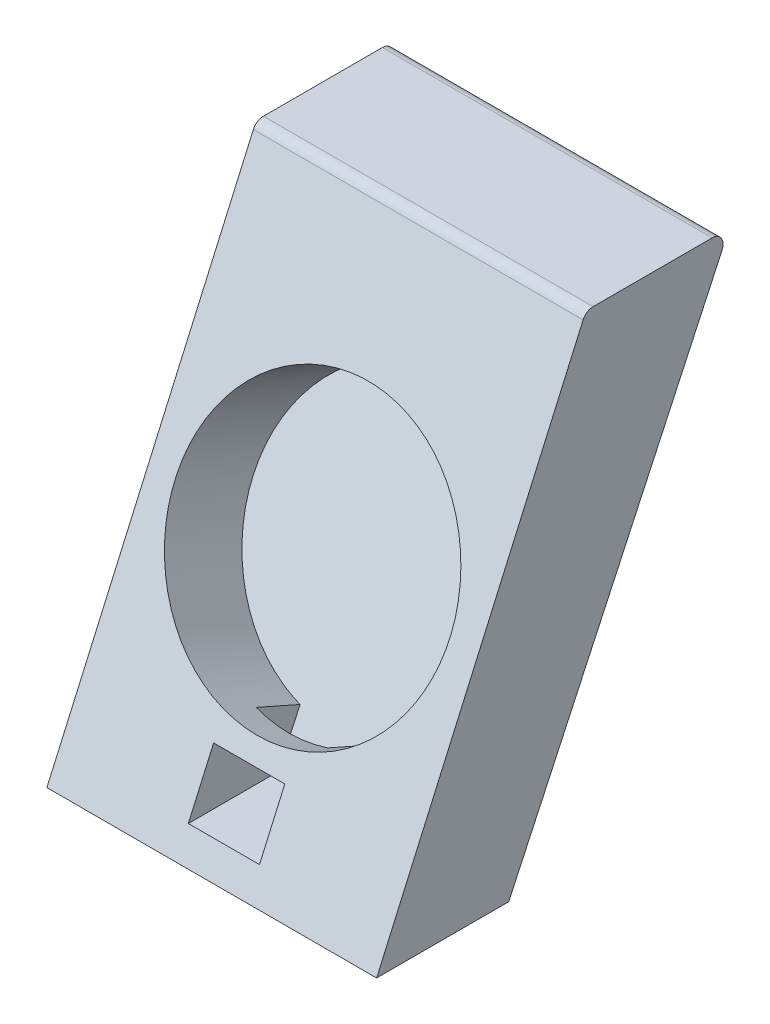
from build123d import *

# Parameters (mm, degrees)
BOSS_EXTRUDE1_DEPTH      = 76.2
FILLET1_R                = 2.54
CUT_EXTRUDE1_REACH       = 157.479
SKETCH2_R                = 31.75
CUT_EXTRUDE6_START       = 4
CUT_EXTRUDE6_DEPTH       = 14.602057312
CUT_EXTRUDE6_START_2     = 18.602057312
CUT_EXTRUDE6_2_DEPTH     = 2.80902025
CUT_EXTRUDE6_START_3     = 12.7
CUT_EXTRUDE6_3_OUTLINE_W = 57
CUT_EXTRUDE6_3_OUTLINE_H = 10
CUT_EXTRUDE6_3_DEPTH     = 2.568810953
CUT_EXTRUDE7_REACH       = 157.479
SKETCH12_W               = 16.443444888
SKETCH12_H               = 13.2134825
CUT_EXTRUDE9_REACH       = 134.385
SKETCH13_W               = 16.443444888
SKETCH13_H               = 11.069902364


with BuildPart() as part:
    # Sketch1 → Boss-Extrude1 (new body)
    with BuildSketch(Plane(origin=(0, 0, 0), x_dir=(0, 0, -1), z_dir=(1, 0, 0))):
        Polygon((0, 0), (30.524795297, 0), (81.513688576, 109.346034506), (48.380392686, 109.346034506), align=None)
    extrude(amount=BOSS_EXTRUDE1_DEPTH)

    # Fillet1
    fillet1_edges = [part.edges().sort_by_distance(p)[0] for p in [
        (38.1, 109.346034506, -48.380392686),
        (38.1, 109.346034506, -81.513688576),
    ]]
    fillet(fillet1_edges, radius=FILLET1_R)

    # Cut-Extrude1: up to this plane
    cut_extrude1_end = Plane(origin=(76.2, 3.803564356, -22.368025214), z_dir=(0, 0.4226182617406973, 0.906307787036651))
    # Sketch2 → Cut-Extrude1 (cut, up to the surface)
    with BuildSketch(Plane(origin=(0, 0, 0), x_dir=(1, 0, 0), z_dir=(0, 0.4046165331441324, 0.9144864466499344)), mode=Mode.PRIVATE) as cut_extrude1_sk1:
        with Locations(Location((37.912855144, 58.087931451, 0), (0, 0, 270))):
            Circle(SKETCH2_R)
    cut_extrude1_tool1 = split(extrude(cut_extrude1_sk1.sketch, amount=-CUT_EXTRUDE1_REACH, mode=Mode.PRIVATE), bisect_by=cut_extrude1_end, keep=Keep.BOTH, mode=Mode.PRIVATE)
    add(cut_extrude1_tool1.solids().sort_by_distance((37.912855, 53.120626, -23.503337))[0], mode=Mode.SUBTRACT)

    # Cut-Extrude6: read off the stored shape, not the designer's step
    # Cut-Extrude6 outline → Cut-Extrude6 (cut)
    with BuildSketch(Plane(origin=(0, 0, 0), x_dir=(1, 0, 0), z_dir=(0, 0.9144864466499345, -0.4046165331441322)).offset(CUT_EXTRUDE6_START)):
        with BuildLine():
            add(Edge.make_bspline(
                [(14.29054348, 10.655346562), (8.791282166, 10.655346562), (11.540912823, 15.416915606), (14.29054348, 20.17848465), (17.040174137, 15.416915606), (19.789804794, 10.655346562), (14.29054348, 10.655346562)],
                knots=[0, 0, 0, 2.094395102, 2.094395102, 4.188790205, 4.188790205, 6.283185307, 6.283185307, 6.283185307], degree=2, weights=[1, 0.5, 1, 0.5, 1, 0.5, 1]))
        make_face()
        with BuildLine():
            add(Edge.make_bspline(
                [(61.90945652, 17.004105287), (67.408717834, 17.004105287), (64.659087177, 12.242536243), (61.90945652, 7.4809672), (59.159825863, 12.242536243), (56.410195206, 17.004105287), (61.90945652, 17.004105287)],
                knots=[0, 0, 0, 2.094395102, 2.094395102, 4.188790205, 4.188790205, 6.283185307, 6.283185307, 6.283185307], degree=2, weights=[1, 0.5, 1, 0.5, 1, 0.5, 1]))
        make_face()
    extrude(amount=CUT_EXTRUDE6_DEPTH, mode=Mode.SUBTRACT)

    # Cut-Extrude6 2 outline → Cut-Extrude6 2 (cut)
    with BuildSketch(Plane(origin=(0, 0, 0), x_dir=(1, 0, 0), z_dir=(0, 0.9144864466499345, -0.4046165331441322)).offset(CUT_EXTRUDE6_START_2)):
        with BuildLine():
            add(Edge.make_bspline(
                [(14.29054348, 10.655346562), (8.791282166, 10.655346562), (11.540912823, 15.416915606), (14.29054348, 20.17848465), (17.040174137, 15.416915606), (19.789804794, 10.655346562), (14.29054348, 10.655346562)],
                knots=[0, 0, 0, 2.094395102, 2.094395102, 4.188790205, 4.188790205, 6.283185307, 6.283185307, 6.283185307], degree=2, weights=[1, 0.5, 1, 0.5, 1, 0.5, 1]))
        make_face()
        with BuildLine():
            add(Edge.make_bspline(
                [(61.90945652, 17.004105287), (67.408717834, 17.004105287), (64.659087177, 12.242536243), (61.90945652, 7.4809672), (59.159825863, 12.242536243), (56.410195206, 17.004105287), (61.90945652, 17.004105287)],
                knots=[0, 0, 0, 2.094395102, 2.094395102, 4.188790205, 4.188790205, 6.283185307, 6.283185307, 6.283185307], degree=2, weights=[1, 0.5, 1, 0.5, 1, 0.5, 1]))
        make_face()
    extrude(amount=CUT_EXTRUDE6_2_DEPTH, mode=Mode.SUBTRACT)

    # Cut-Extrude6 3 outline → Cut-Extrude6 3 (add)
    with BuildSketch(Plane(origin=(0, 0, 0), x_dir=(1, 0, 0), z_dir=(0, 1, 0)).offset(CUT_EXTRUDE6_START_3)):
        with Locations((38.5, 21)):
            Rectangle(CUT_EXTRUDE6_3_OUTLINE_W, CUT_EXTRUDE6_3_OUTLINE_H)
    extrude(amount=CUT_EXTRUDE6_3_DEPTH)

    # Cut-Extrude7: up to this plane
    cut_extrude7_end = Plane(origin=(76.2, 3.803564356, -22.368025214), z_dir=(0, 0.4226182617406973, 0.906307787036651))
    # Sketch12 → Cut-Extrude7 (cut, up to the surface)
    with BuildSketch(Plane.XY, mode=Mode.PRIVATE) as cut_extrude7_sk1:
        with Locations((38.1, 12.95674125)):
            Rectangle(SKETCH12_W, SKETCH12_H)
    cut_extrude7_tool1 = split(extrude(cut_extrude7_sk1.sketch, amount=-CUT_EXTRUDE7_REACH, mode=Mode.PRIVATE), bisect_by=cut_extrude7_end, keep=Keep.BOTH, mode=Mode.PRIVATE)
    add(cut_extrude7_tool1.solids().sort_by_distance((38.1, 12.956741, 0))[0], mode=Mode.SUBTRACT)

    # Cut-Extrude9: up to this face of the body (flat: up to its plane)
    cut_extrude9_end = Plane(part.part.faces().sort_by_distance((38.1, 6.35, -13.182509538))[0])
    # Sketch13 → Cut-Extrude9 (cut, up to the picked face)
    with BuildSketch(Plane(origin=(0, 25.32223957, -11.807954233), x_dir=(-1, 0, 0), z_dir=(0, -0.9063077870366496, 0.4226182617407003)), mode=Mode.PRIVATE) as cut_extrude9_sk1:
        with Locations((-38.1, 13.129908493)):
            Rectangle(SKETCH13_W, SKETCH13_H)
    cut_extrude9_tool1 = split(extrude(cut_extrude9_sk1.sketch, amount=CUT_EXTRUDE9_REACH, mode=Mode.PRIVATE), bisect_by=cut_extrude9_end, keep=Keep.BOTH, mode=Mode.PRIVATE)
    add(cut_extrude9_tool1.solids().sort_by(Axis((38.1, 19.7733, -23.707693), (0, -0.9063077870366496, 0.4226182617407003)))[0], mode=Mode.SUBTRACT)


solid = part.part
